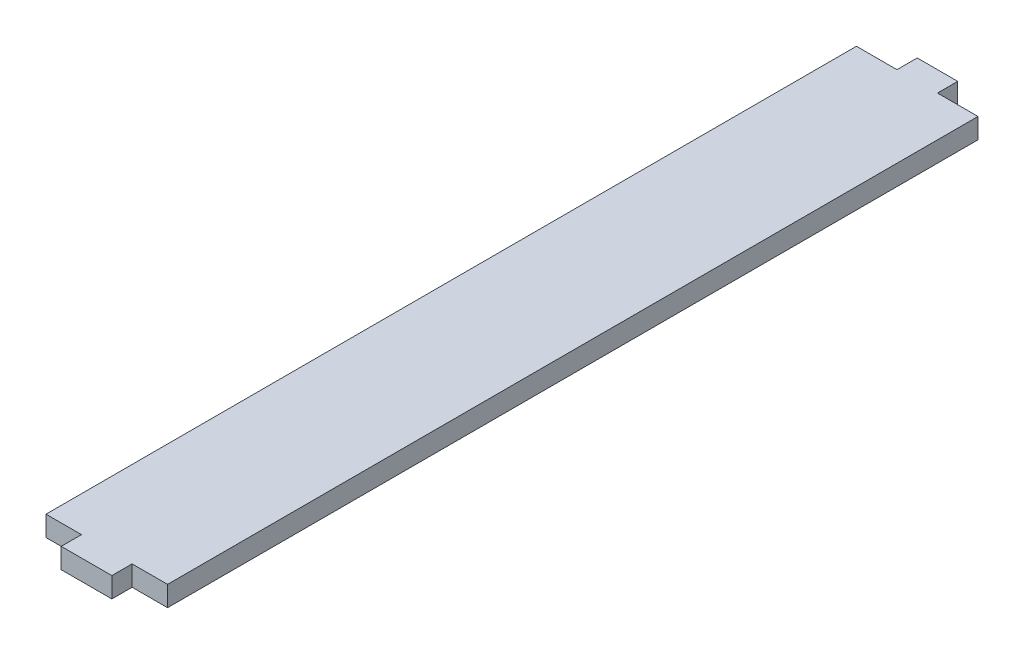
from build123d import *

# Parameters (mm, degrees)
BOSS_EXTRUDE1_DEPTH = 5


with BuildPart() as part:
    # Sketch1 → Boss-Extrude1 (new body)
    with BuildSketch(Plane(origin=(0, 0, 0), x_dir=(1, 0, 0), z_dir=(0, 1, 0))):
        Polygon((76.91678375, -31.56250034), (76.91678375, -36.56250034), (89.41678375, -36.56250034), (89.41678375, -31.56250034), (98.16678375, -31.56250034), (98.16678375, 168.43749966), (88.16678375, 168.43749966), (88.16678375, 173.43749966), (78.16678375, 173.43749966), (78.16678375, 168.43749966), (68.16678375, 168.43749966), (68.16678375, -31.56250034), align=None)
    extrude(amount=BOSS_EXTRUDE1_DEPTH)


solid = part.part
